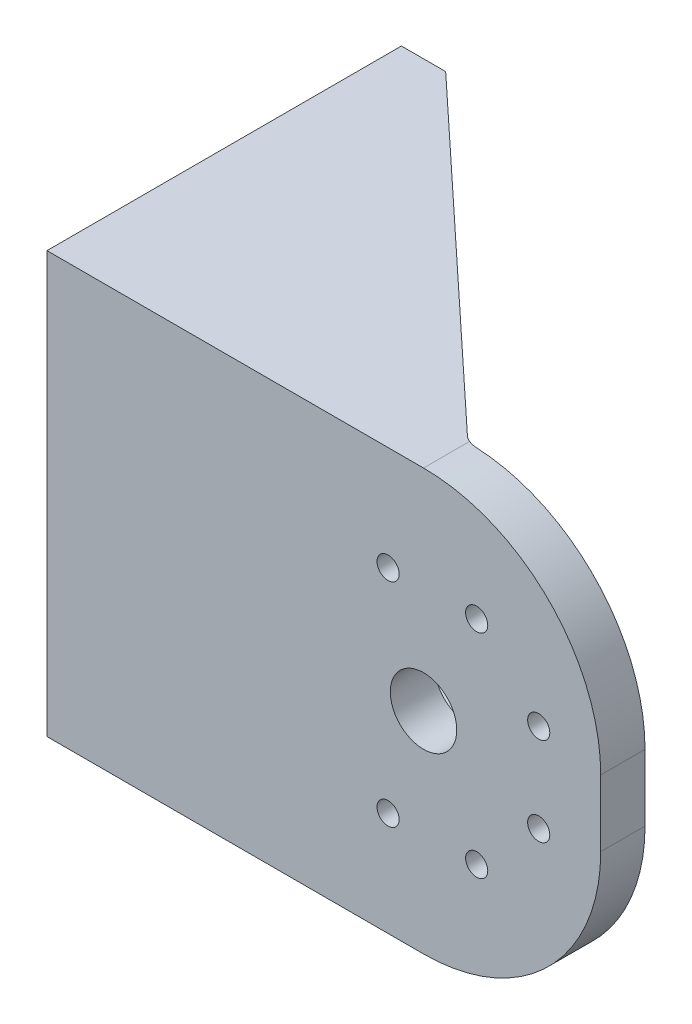
from build123d import *

# Parameters (mm, degrees)
SKETCH3_R           = 7.5
SKETCH3_R_2         = 2.5
BOSS_EXTRUDE1_DEPTH = 10
SKETCH4_W           = 10
SKETCH4_H           = 95
BOSS_EXTRUDE2_DEPTH = 70
SKETCH8_R           = 7.5
SKETCH8_R_2         = 2.5
CUT_EXTRUDE2_DEPTH  = 43.8
BOSS_EXTRUDE3_DEPTH = 10
FILLET1_R           = 5


with BuildPart() as part:
    # Sketch3 → Boss-Extrude1 (new body)
    with BuildSketch(Plane.XY):
        with BuildLine():
            Line((68.617133813, 80.05993294), (153.617133813, 80.05993294))
            ThreePointArc((153.617133813, 80.05993294), (181.90140506, 68.344204188), (193.617133813, 40.05993294))
            Line((193.617133813, 40.05993294), (193.617133813, 25.05993294))
            ThreePointArc((193.617133813, 25.05993294), (181.90140506, -3.224338307), (153.617133813, -14.94006706))
            Line((153.617133813, -14.94006706), (68.617133813, -14.94006706))
            Line((68.617133813, -14.94006706), (68.617133813, 80.05993294))
        make_face()
        with Locations((153.617133813, 32.55993294)):
            Circle(SKETCH3_R, mode=Mode.SUBTRACT)
        with Locations((179.617133813, 42.55993294)):
            Circle(SKETCH3_R_2, mode=Mode.SUBTRACT)
        with Locations((145.617133813, 56.55993294)):
            Circle(SKETCH3_R_2, mode=Mode.SUBTRACT)
        with Locations((165.617133813, 56.55993294)):
            Circle(SKETCH3_R_2, mode=Mode.SUBTRACT)
        with Locations((145.617133813, 8.55993294)):
            Circle(SKETCH3_R_2, mode=Mode.SUBTRACT)
        with Locations((165.617133813, 8.55993294)):
            Circle(SKETCH3_R_2, mode=Mode.SUBTRACT)
        with Locations((179.617133813, 22.55993294)):
            Circle(SKETCH3_R_2, mode=Mode.SUBTRACT)
    extrude(amount=BOSS_EXTRUDE1_DEPTH)

    # Sketch4 → Boss-Extrude2 (add)
    with BuildSketch(Plane(origin=(0, 0, 0), x_dir=(-1, 0, 0), z_dir=(0, 0, -1))):
        with Locations((-73.617133813, 32.55993294)):
            Rectangle(SKETCH4_W, SKETCH4_H)
    extrude(amount=BOSS_EXTRUDE2_DEPTH)

    # Sketch8 → Cut-Extrude2 (cut)
    with BuildSketch(Plane.ZY.offset(-68.617133813)):
        with Locations((-40, 32.55993294)):
            Circle(SKETCH8_R)
        with Locations((-56.167891819, 25.862972874)):
            Circle(SKETCH8_R_2)
        with Locations((-56.167891819, 39.256893006)):
            Circle(SKETCH8_R_2)
        with Locations((-46.696960066, 48.727824759)):
            Circle(SKETCH8_R_2)
        with Locations((-33.303039934, 48.727824759)):
            Circle(SKETCH8_R_2)
        with Locations((-23.832108181, 39.256893006)):
            Circle(SKETCH8_R_2)
        with Locations((-23.832108181, 25.862972874)):
            Circle(SKETCH8_R_2)
        with Locations((-33.303039934, 16.392041121)):
            Circle(SKETCH8_R_2)
        with Locations((-46.696960066, 16.392041121)):
            Circle(SKETCH8_R_2)
    extrude(amount=-CUT_EXTRUDE2_DEPTH, mode=Mode.SUBTRACT)

    # Sketch9 → Boss-Extrude3 (add)
    with BuildSketch(Plane.XZ.offset(14.94006706)):
        Polygon((78.617133813, -70), (153.617133813, 0), (78.617133813, 0), align=None)
    boss_extrude3 = extrude(amount=-BOSS_EXTRUDE3_DEPTH)

    # Mirror1: Boss-Extrude3 across plane
    add(boss_extrude3.mirror(Plane(origin=(0, 32.55993294, 0), x_dir=(0, 0, 1), z_dir=(0, -1, 0))))

    # Fillet1
    fillet1_edges = [part.edges().sort_by_distance(p)[0] for p in [
        (153.617133813, 75.05993294, 0),
        (153.617133813, -9.94006706, 0),
    ]]
    fillet(fillet1_edges, radius=FILLET1_R)


solid = part.part
